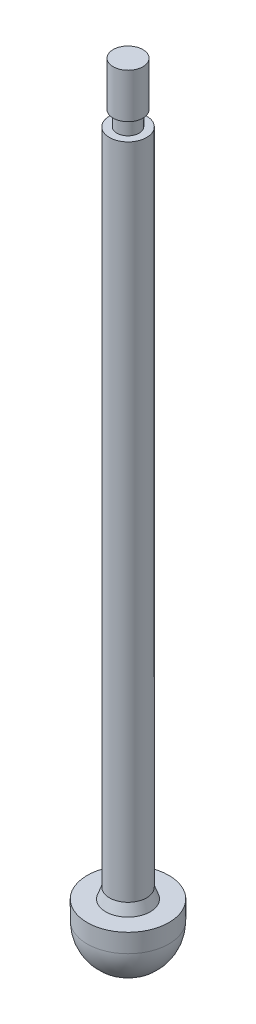
from build123d import *


with BuildPart() as part:
    # Sketch1 → Revolve1 (revolve)
    with BuildSketch(Plane.XY):
        with BuildLine():
            Line((5.5, 0), (5.5, 2.5))
            Line((5.5, 2.5), (3, 2.5))
            Line((3, 2.5), (2.5, 3.87373871))
            Line((2.5, 3.87373871), (2.5, 92.5))
            Line((2.5, 92.5), (1.5, 92.5))
            Line((1.5, 92.5), (1.5, 94.5))
            Line((1.5, 94.5), (2, 94.5))
            Line((2, 94.5), (2, 100.5))
            Line((2, 100.5), (0, 100.5))
            Line((0, 100.5), (0, -5.5))
            ThreePointArc((0, -5.5), (3.889087297, -3.889087297), (5.5, 0))
        make_face()
    revolve(axis=Axis((0, 0, 0), (0, 1, 0)))


solid = part.part
